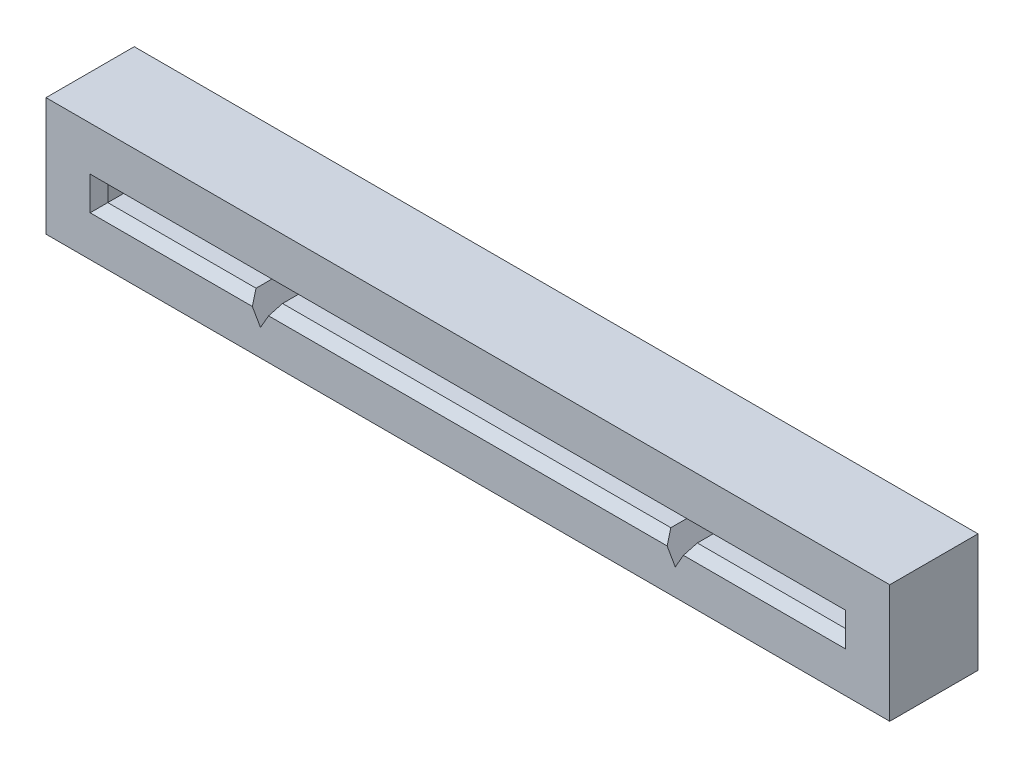
from build123d import *

# Parameters (mm, degrees)
SKETCH_1_W      = 47.8
SKETCH_1_H      = 6.7
EXTRUDE_1_DEPTH = 5
CHAMFER_1_SIZE  = 0.5


with BuildPart() as part:
    # Эскиз1 → Бобышка-Вытянуть1 (new body)
    with BuildSketch(Plane(origin=(0, 66.754264805, 0), x_dir=(-1, 0, 0), z_dir=(0, 0, 1))):
        with Locations((0, 66.654264805)):
            Rectangle(SKETCH_1_W, SKETCH_1_H)
        Polygon((-20.9, 67.204264805), (-20.9, 66.304264805), (20.9, 66.304264805), (20.9, 67.204264805), (12.5, 67.204264805), (11.75, 68.504264805), (11, 67.204264805), (-11, 67.204264805), (-11.75, 68.504264805), (-12.5, 67.204264805), align=None, mode=Mode.SUBTRACT)
    extrude(amount=EXTRUDE_1_DEPTH)

    # Фаска1
    chamfer_1_edges = [part.edges().sort_by_distance(p)[0] for p in [
        (0, -0.45, 5),
        (-16.7, -0.45, 5),
        (-20.9, 0, 5),
        (16.7, -0.45, 5),
        (20.9, 0, 5),
        (0, 0.45, 5),
    ]]
    chamfer(chamfer_1_edges, length=CHAMFER_1_SIZE)


solid = part.part
